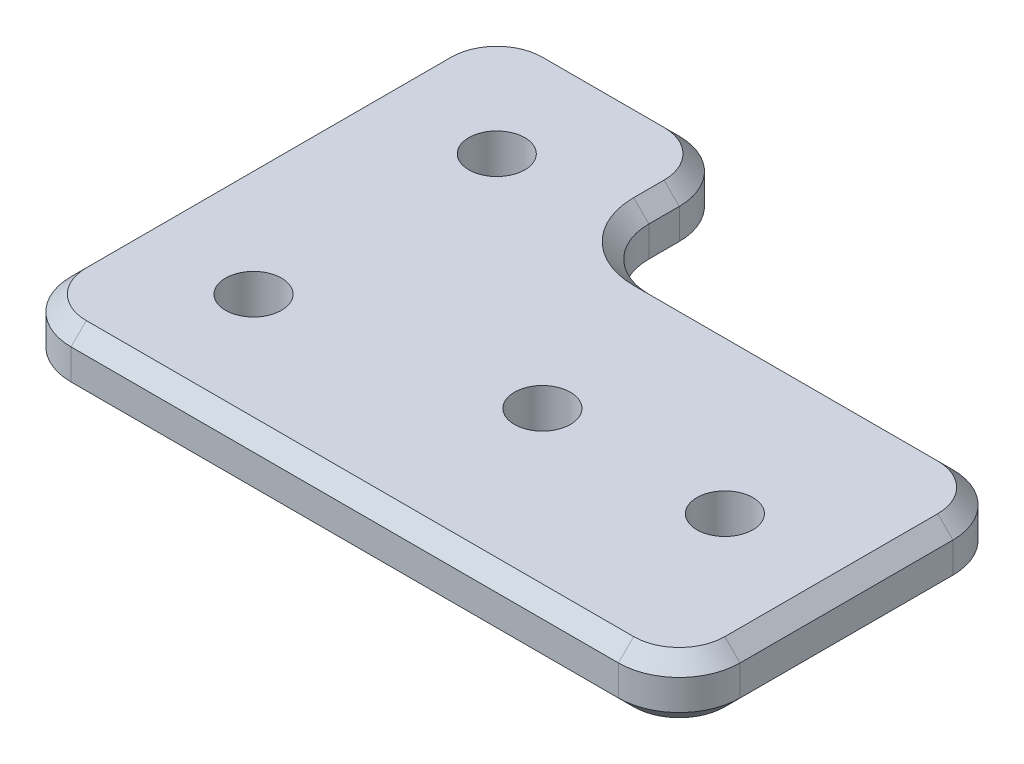
from build123d import *

# Parameters (mm, degrees)
SKETCH1_W           = 69.85
SKETCH1_H           = 6.35
BOSS_EXTRUDE1_DEPTH = 25.4
SKETCH2_R           = 2.921
CUT_EXTRUDE1_DEPTH  = 75.59560979
SKETCH3_W           = 44.45
SKETCH3_H           = 15.875
CUT_EXTRUDE2_DEPTH  = 75.59560979
FILLET1_R           = 6.35
CHAMFER2_SIZE       = 1.5875
SKETCH4_R           = 2.921
CUT_EXTRUDE3_DEPTH  = 75.59560979


with BuildPart() as part:
    # Sketch1 → Boss-Extrude1 (new, symmetric)
    with BuildSketch(Plane.XY):
        with Locations((34.925, 3.175)):
            Rectangle(SKETCH1_W, SKETCH1_H)
    extrude(amount=BOSS_EXTRUDE1_DEPTH, both=True)

    # Sketch2 → Cut-Extrude1 (cut, through all)
    with BuildSketch(Plane(origin=(0, 6.35, 0), x_dir=(1, 0, 0), z_dir=(0, 1, 0))):
        with Locations((12.7, 12.7)):
            Circle(SKETCH2_R)
        with Locations((12.7, -12.7)):
            Circle(SKETCH2_R)
    extrude(amount=-CUT_EXTRUDE1_DEPTH, mode=Mode.SUBTRACT)

    # Sketch3 → Cut-Extrude2 (cut, through all)
    with BuildSketch(Plane(origin=(0, 6.35, 0), x_dir=(1, 0, 0), z_dir=(0, 1, 0))):
        with Locations((47.625, 17.4625)):
            Rectangle(SKETCH3_W, SKETCH3_H)
    extrude(amount=-CUT_EXTRUDE2_DEPTH, mode=Mode.SUBTRACT)

    # Fillet1
    fillet1_edges = [part.edges().sort_by_distance(p)[0] for p in [
        (0, 3.175, 25.4),
        (0, 3.175, -25.4),
        (25.4, 3.175, -25.4),
        (25.4, 3.175, -9.525),
        (69.85, 3.175, 25.4),
        (69.85, 3.175, -9.525),
    ]]
    fillet(fillet1_edges, radius=FILLET1_R)

    # Chamfer2
    chamfer2_edges = [part.edges().sort_by_distance(p)[0] for p in [
        (1.859871939, 0, 23.540128061),
        (34.925, 0, 25.4),
        (67.990128061, 0, 23.540128061),
        (69.85, 0, 7.9375),
        (67.990128061, 0, -7.665128061),
        (47.625, 0, -9.525),
        (27.259871939, 0, -11.384871939),
        (25.4, 0, -17.4625),
        (23.540128061, 0, -23.540128061),
        (12.7, 0, -25.4),
        (0, 0, 0),
        (1.859871939, 0, -23.540128061),
        (1.859871939, 6.35, 23.540128061),
        (34.925, 6.35, 25.4),
        (67.990128061, 6.35, 23.540128061),
        (69.85, 6.35, 7.9375),
        (67.990128061, 6.35, -7.665128061),
        (47.625, 6.35, -9.525),
        (27.259871939, 6.35, -11.384871939),
        (25.4, 6.35, -17.4625),
        (23.540128061, 6.35, -23.540128061),
        (12.7, 6.35, -25.4),
        (1.859871939, 6.35, -23.540128061),
        (0, 6.35, 0),
    ]]
    chamfer(chamfer2_edges, length=CHAMFER2_SIZE)

    # Sketch4 → Cut-Extrude3 (cut, through all)
    with BuildSketch(Plane(origin=(0, 6.35, 0), x_dir=(1, 0, 0), z_dir=(0, 1, 0))):
        with Locations((57.15, -7.9375)):
            Circle(SKETCH4_R)
        with Locations((38.1, -7.9375)):
            Circle(SKETCH4_R)
    extrude(amount=-CUT_EXTRUDE3_DEPTH, mode=Mode.SUBTRACT)


solid = part.part
